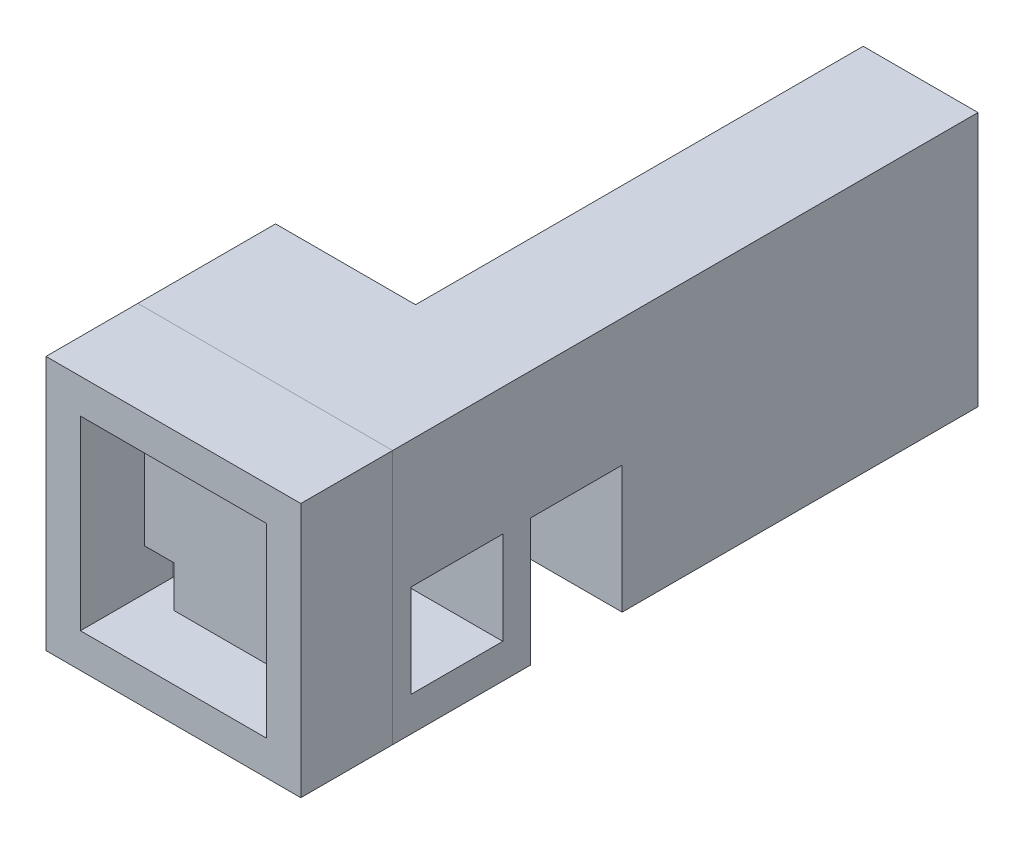
from build123d import *

# Parameters (mm, degrees)
SKETCH2_W           = 3.5
SKETCH2_H           = 8.1
BOSS_EXTRUDE1_DEPTH = 19.5
BOSS_EXTRUDE2_START = 19.5
SKETCH2_3_W         = 0.55
SKETCH2_3_H         = 1.5
SKETCH2_3_W_2       = 3.5
SKETCH2_3_H_2       = 8.1
BOSS_EXTRUDE2_DEPTH = 1.2
BOSS_EXTRUDE3_START = 20.7
BOSS_EXTRUDE3_DEPTH = 8.8
BOSS_EXTRUDE4_START = 26.7
SKETCH2_7_W         = 4.6
SKETCH2_7_H         = 8.1
SKETCH2_7_W_2       = 3.5
BOSS_EXTRUDE4_DEPTH = 1.2
SKETCH4_W           = 1.275
SKETCH4_H           = 1.8
CUT_EXTRUDE1_DEPTH  = 1.2
SKETCH5_W           = 4
SKETCH5_H           = 5.55
CUT_EXTRUDE2_DEPTH  = 32.616767703
SKETCH6_W           = 1.5
SKETCH6_H           = 4.05
CUT_EXTRUDE3_DEPTH  = 4


# Read off the part's stored shape, not the designer's step: Split1
with BuildPart() as part:
    # Sketch2 → Boss-Extrude1 (new body)
    with BuildSketch(Plane.XY):
        Polygon((8.1, 0), (4.6, 0), (4.6, -1.5), (9.6, -1.5), (9.6, 9.6), (4.6, 9.6), (4.6, 8.1), (8.1, 8.1), align=None)
        with Locations((6.35, 4.05)):
            Rectangle(SKETCH2_W, SKETCH2_H)
    extrude(amount=BOSS_EXTRUDE1_DEPTH)

    # Sketch2<3> → Boss-Extrude2 (add)
    with BuildSketch(Plane.XY.offset(BOSS_EXTRUDE2_START)):
        Polygon((4.05, 0), (0, 0), (0, 4.05), (-1.5, 4.05), (-1.5, -1.5), (4.05, -1.5), align=None)
        Polygon((-1.5, 4.05), (0, 4.05), (0, 8.1), (4.6, 8.1), (4.6, 9.6), (-1.5, 9.6), align=None)
        Polygon((0, 4.05), (0, 0), (4.05, 0), (4.6, 0), (4.6, 8.1), (0, 8.1), align=None)
        with Locations((4.325, -0.75)):
            Rectangle(SKETCH2_3_W, SKETCH2_3_H)
        Polygon((8.1, 0), (4.6, 0), (4.6, -1.5), (9.6, -1.5), (9.6, 9.6), (4.6, 9.6), (4.6, 8.1), (8.1, 8.1), align=None)
        with Locations((6.35, 4.05)):
            Rectangle(SKETCH2_3_W_2, SKETCH2_3_H_2)
    extrude(amount=BOSS_EXTRUDE2_DEPTH)

    # Sketch2<5> → Boss-Extrude3 (add)
    with BuildSketch(Plane.XY.offset(BOSS_EXTRUDE3_START)):
        Polygon((4.6, 0), (0, 0), (0, 8.1), (4.6, 8.1), (4.6, 9.6), (-1.5, 9.6), (-1.5, -1.5), (4.6, -1.5), align=None)
        Polygon((8.1, 0), (4.6, 0), (4.6, -1.5), (9.6, -1.5), (9.6, 9.6), (4.6, 9.6), (4.6, 8.1), (8.1, 8.1), align=None)
    extrude(amount=BOSS_EXTRUDE3_DEPTH)

    # Sketch2<7> → Boss-Extrude4 (add)
    with BuildSketch(Plane.XY.offset(BOSS_EXTRUDE4_START)):
        Polygon((4.6, 0), (0, 0), (0, 8.1), (4.6, 8.1), (4.6, 9.6), (-1.5, 9.6), (-1.5, -1.5), (4.6, -1.5), align=None)
        with Locations((2.3, 4.05)):
            Rectangle(SKETCH2_7_W, SKETCH2_7_H)
        Polygon((8.1, 0), (4.6, 0), (4.6, -1.5), (9.6, -1.5), (9.6, 9.6), (4.6, 9.6), (4.6, 8.1), (8.1, 8.1), align=None)
        with Locations((6.35, 4.05)):
            Rectangle(SKETCH2_7_W_2, SKETCH2_7_H)
    extrude(amount=-BOSS_EXTRUDE4_DEPTH)


with BuildPart() as body_2:
    # Split1: the piece on the far side of the plane
    add(part.part)
    split(bisect_by=Plane.XY.offset(25.5), keep=Keep.BOTTOM)

    # Sketch5 → Cut-Extrude2 (cut, through all)
    with BuildSketch(Plane.ZY.offset(-4.6)):
        with Locations((17.5, 1.275)):
            Rectangle(SKETCH5_W, SKETCH5_H)
    extrude(amount=-CUT_EXTRUDE2_DEPTH, mode=Mode.SUBTRACT)

    # Sketch6 → Cut-Extrude3 (cut)
    with BuildSketch(Plane.XY.offset(20.7)):
        with Locations((8.85, 2.025)):
            Rectangle(SKETCH6_W, SKETCH6_H)
    extrude(amount=CUT_EXTRUDE3_DEPTH, mode=Mode.SUBTRACT)


with BuildPart() as part_1:
    add(part.part)

    # Split1
    split(bisect_by=Plane.XY.offset(25.5), keep=Keep.TOP)

    # Sketch4 → Cut-Extrude1 (cut)
    with BuildSketch(Plane.XY.offset(26.7)):
        with Locations((0.6375, 0.9)):
            Rectangle(SKETCH4_W, SKETCH4_H)
        with Locations((7.4625, 0.9)):
            Rectangle(SKETCH4_W, SKETCH4_H)
        with Locations((0.6375, 7.2)):
            Rectangle(SKETCH4_W, SKETCH4_H)
        with Locations((7.4625, 7.2)):
            Rectangle(SKETCH4_W, SKETCH4_H)
    extrude(amount=-CUT_EXTRUDE1_DEPTH, mode=Mode.SUBTRACT)


solid = Compound([body_2.part, part_1.part])
